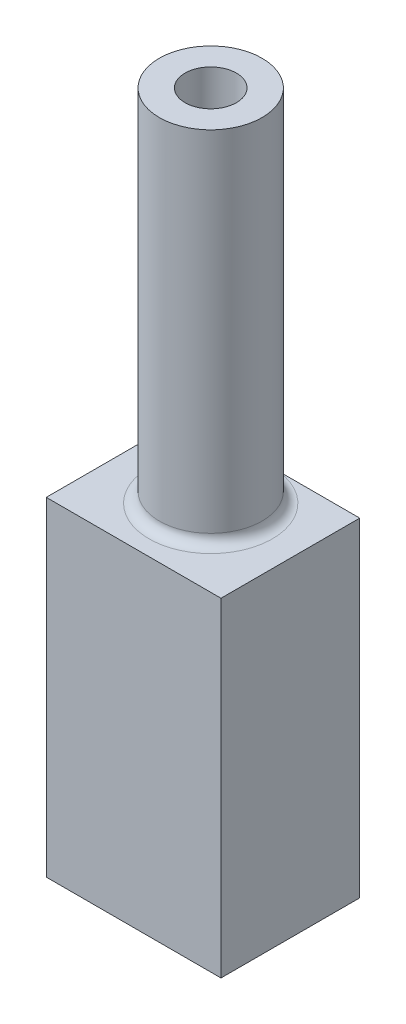
from build123d import *

# Parameters (mm, degrees)
BOSS_EXTRUDE1_DEPTH = 6
SKETCH2_R           = 5
BOSS_EXTRUDE2_DEPTH = 35
FILLET1_R           = 1
SKETCH3_W           = 17
SKETCH3_H           = 32
BOSS_EXTRUDE3_DEPTH = 1.5
CUT_EXTRUDE1_REACH  = 69.952
SKETCH4_R           = 2.5


with BuildPart() as part:
    # Sketch1 → Boss-Extrude1 (new, symmetric)
    with BuildSketch(Plane.XY):
        Polygon((-6.5, -14), (-6.5, 14), (6.5, 14), (6.5, -14), (4.5, -14), (4.5, -16), (8.5, -16), (8.5, 16), (-8.5, 16), (-8.5, -16), (-4.5, -16), (-4.5, -14), align=None)
    extrude(amount=BOSS_EXTRUDE1_DEPTH, both=True)

    # Sketch2 → Boss-Extrude2 (add)
    with BuildSketch(Plane(origin=(0, 16, 0), x_dir=(1, 0, 0), z_dir=(0, 1, 0))):
        with Locations(Location((0, 0, 0), (0, 0, 270))):
            Circle(SKETCH2_R)
    extrude(amount=BOSS_EXTRUDE2_DEPTH)

    # Fillet1
    fillet1_edges = [part.edges().sort_by_distance(p)[0] for p in [
        (0, 16, -5),
    ]]
    fillet(fillet1_edges, radius=FILLET1_R - 0.0001)  # a hair under: the kernel refuses the full size

    # Sketch3 → Boss-Extrude3 (add)
    with BuildSketch(Plane.XY.offset(6)):
        Rectangle(SKETCH3_W, SKETCH3_H)
    extrude(amount=BOSS_EXTRUDE3_DEPTH)

    # Sketch4 → Cut-Extrude1 (cut, up to next)
    with BuildSketch(Plane(origin=(0, 51, 0), x_dir=(1, 0, 0), z_dir=(0, 1, 0)), mode=Mode.PRIVATE) as cut_extrude1_sk1:
        with Locations(Location((0, 0, 0), (0, 0, 270))):
            Circle(SKETCH4_R)
    cut_extrude1_tool1 = extrude(cut_extrude1_sk1.sketch, amount=-CUT_EXTRUDE1_REACH, mode=Mode.PRIVATE) & part.part
    add(cut_extrude1_tool1.solids().sort_by_distance((0, 51, 0))[0], mode=Mode.SUBTRACT)


solid = part.part
